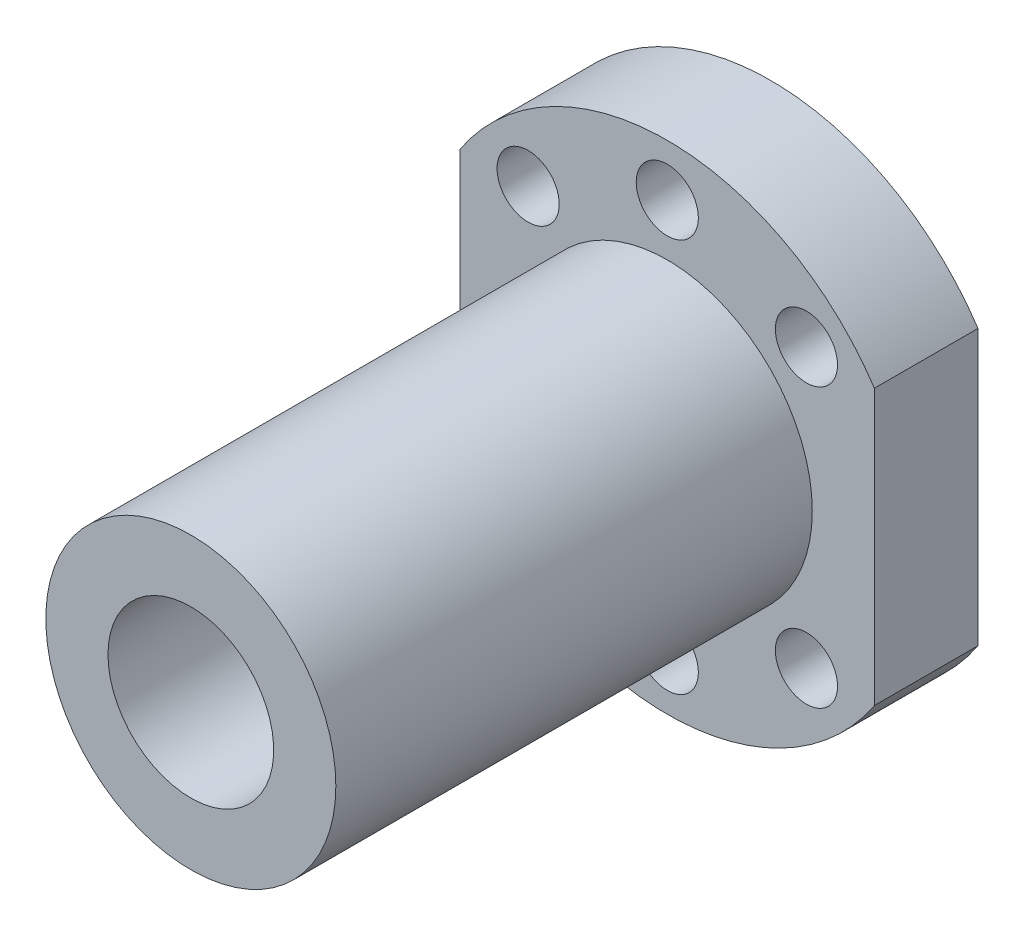
from build123d import *

# Parameters (mm, degrees)
SKETCH1_R                  = 24
EXTRUDE1_DEPTH             = 10
SKETCH2_R                  = 14
EXTRUDE2_DEPTH             = 46
EXTRUDE3_START             = -10
EXTRUDE3_DEPTH             = 10
F_6_0_6_DIAMETER_HOLE1_D   = 6
CIRPATTERN1_COUNT          = 8
F_25_0_25_DIAMETER_HOLE1_D = 16


# Read off the part's stored shape, not the designer's step: Extrude3
with BuildPart() as part:
    # Sketch1 → Extrude1 (new body)
    with BuildSketch(Plane.XY):
        Circle(SKETCH1_R)
    extrude(amount=EXTRUDE1_DEPTH)

    # Sketch2 → Extrude2 (add)
    with BuildSketch(Plane.XY.offset(10)):
        Circle(SKETCH2_R)
    extrude(amount=EXTRUDE2_DEPTH)

    # Extrude3 outline → Extrude3 (cut)
    with BuildSketch(Plane(origin=(0, 0, 0), x_dir=(-1, 0, 0), z_dir=(0, 0, -1)).offset(EXTRUDE3_START)):
        with BuildLine():
            Line((-20, -13.266499161), (-20, 13.266499161))
            ThreePointArc((-20, 13.266499161), (-24, 0), (-20, -13.266499161))
        make_face()
        with BuildLine():
            ThreePointArc((20, -13.266499161), (24, 0), (20, 13.266499161))
            Line((20, 13.266499161), (20, -13.266499161))
        make_face()
    extrude(amount=EXTRUDE3_DEPTH, mode=Mode.SUBTRACT)

    # Ø6.0 (6) Diameter Hole1 (through all)
    with Locations(Plane(origin=(0, 0, 0), x_dir=(-1, 0, 0), z_dir=(0, 0, -1))):
        with Locations((0, 19)):
            f_6_0_6_diameter_hole1 = Hole(F_6_0_6_DIAMETER_HOLE1_D / 2)

    # CirPattern1: Ø6.0 (6) Diameter Hole1 ×8 about axis, 2 skipped
    cirpattern1_axis = Axis((0, 0, 0), (0, 0, 1))
    add([f_6_0_6_diameter_hole1.rotate(cirpattern1_axis, i * 360 / CIRPATTERN1_COUNT) for i in range(1, CIRPATTERN1_COUNT) if i not in (2, 6)], mode=Mode.SUBTRACT)

    # Ø25.0 (25) Diameter Hole1 (through all)
    with Locations(Plane(origin=(0, 0, 0), x_dir=(-1, 0, 0), z_dir=(0, 0, -1))):
        with Locations((0, 0)):
            Hole(F_25_0_25_DIAMETER_HOLE1_D / 2)


solid = part.part
